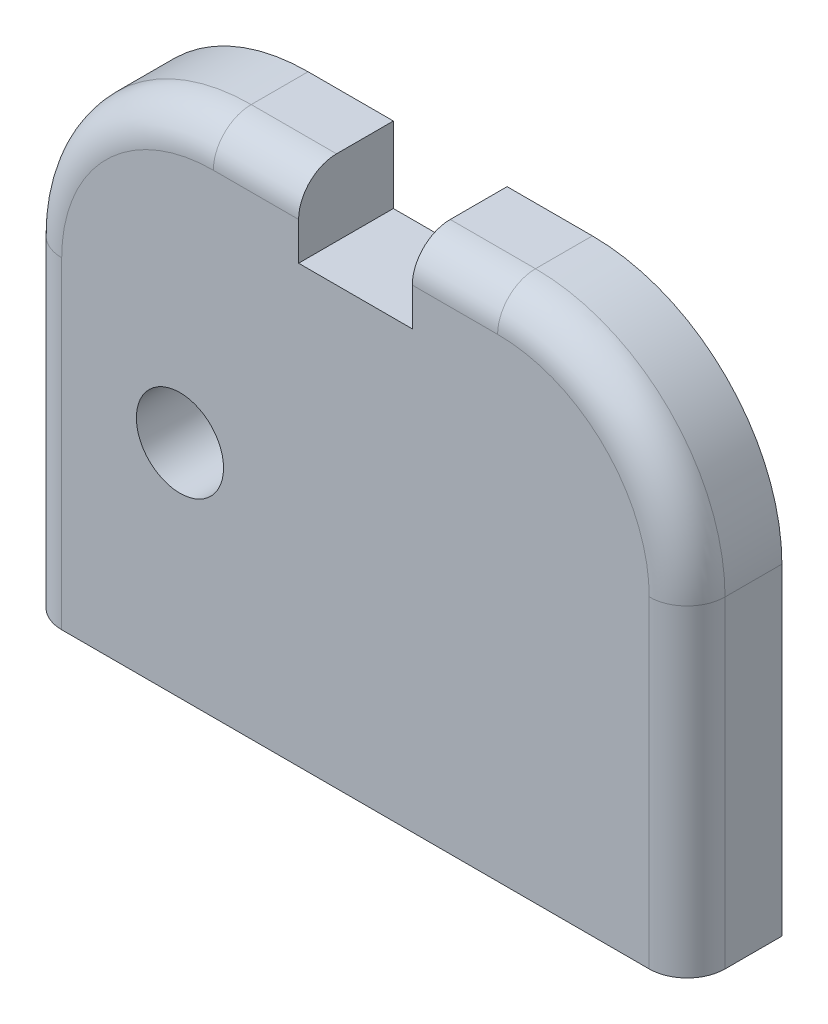
from build123d import *

# Parameters (mm, degrees)
BOSS_EXTRUDE1_DEPTH              = 5
FILLET1_R                        = 10
FILLET2_R                        = 2
SKETCH2_R                        = 6.5
SKETCH2_R_2                      = 2.3
SKETCH2_R_3                      = 6.2
BOSS_EXTRUDE2_DEPTH              = 1
FILLET3_R                        = 1.5
TAP_DRILL_SLOT_FOR_M2_TAP1_D     = 1.6
TAP_DRILL_SLOT_FOR_M2_TAP1_DEPTH = 4
TAP_DRILL_SLOT_FOR_M2_TAP1_TIP   = 0.480688495
SKETCH3_R                        = 2.3
BOSS_EXTRUDE3_DEPTH              = 2
SKETCH8_R                        = 2.3
CUT_EXTRUDE1_DEPTH               = 10


with BuildPart() as part:
    # Sketch1 → Boss-Extrude1 (new body)
    with BuildSketch(Plane.XY):
        Polygon((3, 13.5), (3, 9.5), (-3, 9.5), (-3, 13.5), (-17.5, 13.5), (-17.5, -13.5), (17.5, -13.5), (17.5, 13.5), align=None)
    extrude(amount=BOSS_EXTRUDE1_DEPTH)

    # Fillet1
    fillet1_edges = [part.edges().sort_by_distance(p)[0] for p in [
        (17.5, 13.5, 2.5),
        (-17.5, 13.5, 2.5),
    ]]
    fillet(fillet1_edges, radius=FILLET1_R)

    # Fillet2
    fillet2_edges = [part.edges().sort_by_distance(p)[0] for p in [
        (-5.25, 13.5, 5),
        (-17.5, -5, 5),
        (17.5, -5, 5),
        (5.25, 13.5, 5),
        (14.571067812, 10.571067812, 5),
        (-14.571067812, 10.571067812, 5),
    ]]
    fillet(fillet2_edges, radius=FILLET2_R)

    # Sketch2 → Boss-Extrude2 (add)
    # profile 1 of 2: a face of its own
    with BuildSketch(Plane(origin=(0, 0, 0), x_dir=(-1, 0, 0), z_dir=(0, 0, -1))):
        with Locations(Location((9.261392854, -1.840391381, 0), (0, 0, 180))):
            Circle(SKETCH2_R)
        with Locations((9.261392854, -1.840391381)):
            Circle(SKETCH2_R_2, mode=Mode.SUBTRACT)
    # profile 2 of 2: a face of its own
    with BuildSketch(Plane(origin=(0, 0, 0), x_dir=(-1, 0, 0), z_dir=(0, 0, -1))):
        with Locations(Location((-9.15, -2, 0), (0, 0, 180))):
            Circle(SKETCH2_R_3)
    extrude(amount=BOSS_EXTRUDE2_DEPTH)

    # Fillet3
    # the kernel refuses this fillet: 1.5 mm, written as the material it adds along each edge
    with BuildSketch(Plane(origin=(-9.261392854, -1.840391381, 0), x_dir=(1, 0, 0), z_dir=(0, 1, 0))) as fillet3_piece_1:
        with BuildLine():
            CenterArc((7.914213562, 1.5), FILLET3_R, 199.471220634, 70.528779366)
            Line((6.5, 1), (6.471715729, 0.99))
            ThreePointArc((6.471715729, 0.99), (6.47, 0.5), (6.47, 0))
            Line((6.47, 0), (6.5, -0.03))
            Line((6.5, -0.03), (7.914213562, -0.03))
            Line((7.914213562, -0.03), (7.914213562, 0))
        make_face()
    revolve(axis=Axis((-9.261392854, -1.840391381, 0), (0, 0, -1)))
    with BuildSketch(Plane(origin=(9.15, -2, 0), x_dir=(1, 0, 0), z_dir=(0, 1, 0))) as fillet3_piece_2:
        with BuildLine():
            CenterArc((7.614213562, 1.5), FILLET3_R, 199.471220634, 70.528779366)
            Line((6.2, 1), (6.171715729, 0.99))
            ThreePointArc((6.171715729, 0.99), (6.17, 0.5), (6.17, 0))
            Line((6.17, 0), (6.2, -0.03))
            Line((6.2, -0.03), (7.614213562, -0.03))
            Line((7.614213562, -0.03), (7.614213562, 0))
        make_face()
    revolve(axis=Axis((9.15, -2, 0), (0, 0, -1)))

    # Tap Drill Slot for M2 Tap1
    with Locations(Plane(origin=(0, -13.5, 0), x_dir=(-1, 0, 0), z_dir=(0, -1, 0))):
        with Locations((-10.007456689, -2.505236507), (0, -2.505236507), (10, -2.5)):
            Hole(TAP_DRILL_SLOT_FOR_M2_TAP1_D / 2, depth=TAP_DRILL_SLOT_FOR_M2_TAP1_DEPTH)
            with Locations((0, 0, -(TAP_DRILL_SLOT_FOR_M2_TAP1_DEPTH + TAP_DRILL_SLOT_FOR_M2_TAP1_TIP / 2))):  # 118° drill point
                Cone(0, TAP_DRILL_SLOT_FOR_M2_TAP1_D / 2, TAP_DRILL_SLOT_FOR_M2_TAP1_TIP, mode=Mode.SUBTRACT)

    # Sketch3 → Boss-Extrude3 (add)
    with BuildSketch(Plane(origin=(0, 0, -1), x_dir=(-1, 0, 0), z_dir=(0, 0, -1))):
        with Locations((-9.15, -2)):
            Circle(SKETCH3_R)
    extrude(amount=BOSS_EXTRUDE3_DEPTH)

    # Sketch8 → Cut-Extrude1 (cut)
    with BuildSketch(Plane.XY.offset(5)):
        with Locations((-9.261392854, -1.840391381)):
            Circle(SKETCH8_R)
    extrude(amount=-CUT_EXTRUDE1_DEPTH, mode=Mode.SUBTRACT)


solid = part.part
